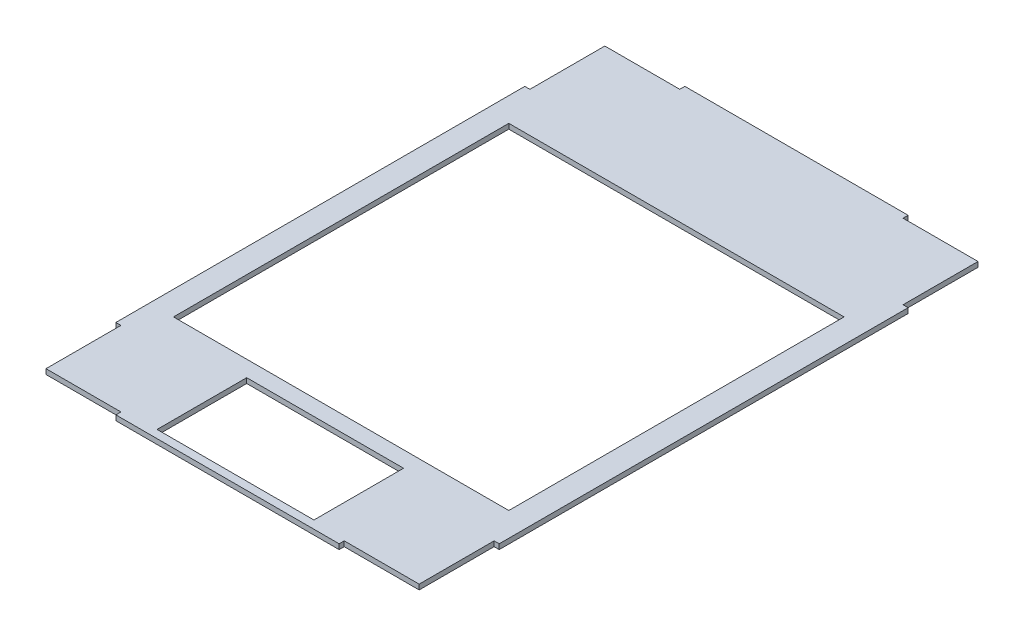
from build123d import *

# Parameters (mm, degrees)
SKETCH1_W           = 479
SKETCH1_H           = 711
SKETCH1_W_2         = 419
SKETCH1_H_2         = 419
SKETCH1_W_3         = 196
SKETCH1_H_3         = 112
BOSS_EXTRUDE1_DEPTH = 3.175
CUT_EXTRUDE1_DEPTH  = 433.019470047


with BuildPart() as part:
    # Sketch1 → Boss-Extrude1 (new, symmetric)
    with BuildSketch(Plane(origin=(0, 0, 0), x_dir=(1, 0, 0), z_dir=(0, 1, 0))):
        with Locations((0, 4)):
            Rectangle(SKETCH1_W, SKETCH1_H)
        Rectangle(SKETCH1_W_2, SKETCH1_H_2, mode=Mode.SUBTRACT)
        with Locations((0, -285.5)):
            Rectangle(SKETCH1_W_3, SKETCH1_H_3, mode=Mode.SUBTRACT)
    extrude(amount=BOSS_EXTRUDE1_DEPTH, both=True)

    # Sketch2 → Cut-Extrude1 (cut, through all)
    with BuildSketch(Plane(origin=(0, 3.175, 0), x_dir=(1, 0, 0), z_dir=(0, 1, 0))):
        Polygon((-239.5, 359.5), (-239.5, 259.5), (-233.15, 259.5), (-233.15, 353.15), (-139.5, 353.15), (-139.5, 359.5), align=None)
        Polygon((239.5, 359.5), (139.5, 359.5), (139.5, 353.15), (233.15, 353.15), (233.15, 259.5), (239.5, 259.5), align=None)
        Polygon((239.5, -351.5), (239.5, -251.5), (233.15, -251.5), (233.15, -345.15), (139.5, -345.15), (139.5, -351.5), align=None)
        Polygon((-239.5, -351.5), (-139.5, -351.5), (-139.5, -345.15), (-233.15, -345.15), (-233.15, -251.5), (-239.5, -251.5), align=None)
    extrude(amount=-CUT_EXTRUDE1_DEPTH, mode=Mode.SUBTRACT)


solid = part.part
